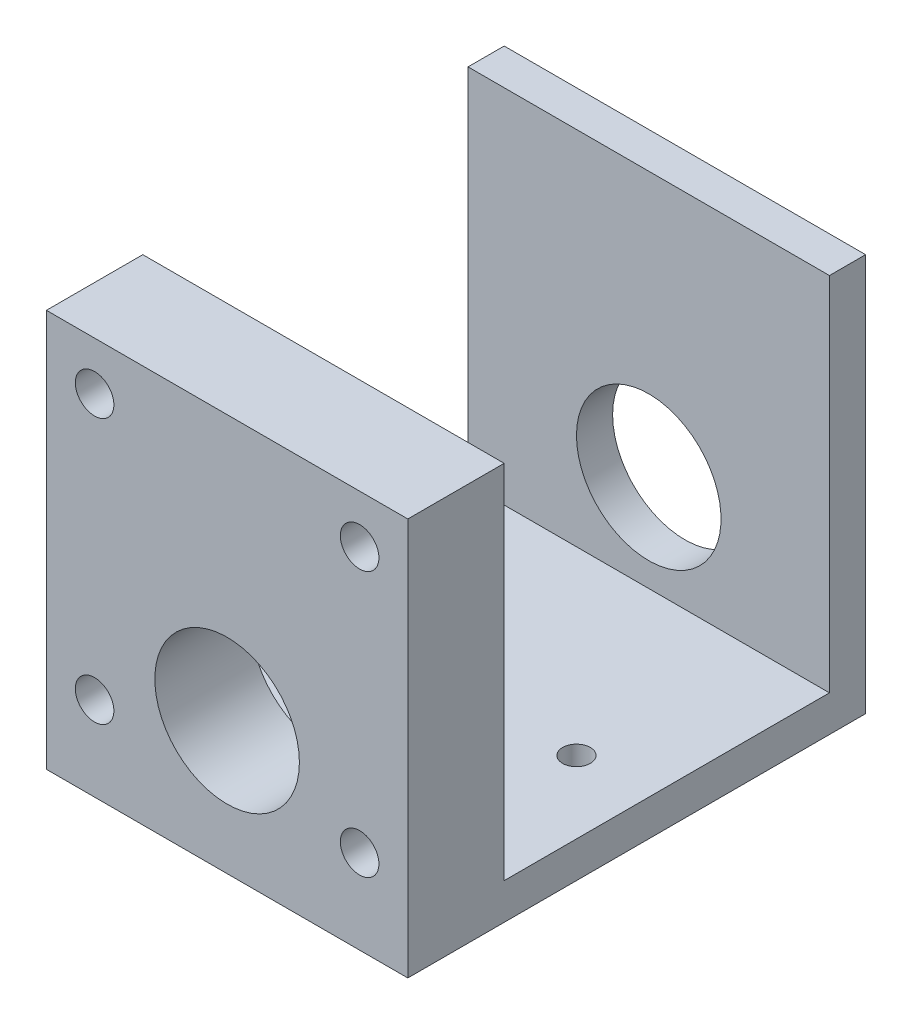
from build123d import *

# Parameters (mm, degrees)
SKETCH1_W           = 30
SKETCH1_H           = 30
SKETCH1_R           = 1.15
BOSS_EXTRUDE1_DEPTH = 3
SKETCH2_W           = 30
SKETCH2_H           = 3
BOSS_EXTRUDE2_DEPTH = 30
CUT_EXTRUDE1_REACH  = 55.749
SKETCH3_R           = 6
SKETCH4_W           = 30
SKETCH4_H           = 33
SKETCH4_R           = 6
BOSS_EXTRUDE3_DEPTH = 3
CUT_EXTRUDE3_REACH  = 57.48
SKETCH5_R           = 1.6
BOSS_EXTRUDE4_START = 5
SKETCH6_W           = 30
SKETCH6_H           = 33
SKETCH6_R           = 6
SKETCH6_R_2         = 1.6
BOSS_EXTRUDE4_DEPTH = 5


with BuildPart() as part:
    # Sketch1 → Boss-Extrude1 (new body)
    with BuildSketch(Plane(origin=(0, 0, 0), x_dir=(1, 0, 0), z_dir=(0, 1, 0))):
        with Locations((15, 15)):
            Rectangle(SKETCH1_W, SKETCH1_H)
        with Locations((5.999988, 12)):
            Circle(SKETCH1_R, mode=Mode.SUBTRACT)
        with Locations((23.999988, 12)):
            Circle(SKETCH1_R, mode=Mode.SUBTRACT)
    extrude(amount=BOSS_EXTRUDE1_DEPTH)

    # Sketch2 → Boss-Extrude2 (add)
    with BuildSketch(Plane(origin=(0, 3, 0), x_dir=(1, 0, 0), z_dir=(0, 1, 0))):
        with Locations((15, 28.5)):
            Rectangle(SKETCH2_W, SKETCH2_H)
    extrude(amount=BOSS_EXTRUDE2_DEPTH)

    # Sketch3 → Cut-Extrude1 (cut, up to next)
    with BuildSketch(Plane(origin=(0, 0, -30), x_dir=(-1, 0, 0), z_dir=(0, 0, -1)), mode=Mode.PRIVATE) as cut_extrude1_sk1:
        with Locations((-15, 11)):
            Circle(SKETCH3_R)
    cut_extrude1_tool1 = extrude(cut_extrude1_sk1.sketch, amount=-CUT_EXTRUDE1_REACH, mode=Mode.PRIVATE) & part.part
    add(cut_extrude1_tool1.solids().sort_by_distance((15, 11, -30))[0], mode=Mode.SUBTRACT)

    # Sketch4 → Boss-Extrude3 (add)
    with BuildSketch(Plane.XY):
        with Locations((15, 16.5)):
            Rectangle(SKETCH4_W, SKETCH4_H)
        with Locations((15, 11)):
            Circle(SKETCH4_R, mode=Mode.SUBTRACT)
    extrude(amount=BOSS_EXTRUDE3_DEPTH)

    # Sketch5 → Cut-Extrude3 (cut, up to next)
    with BuildSketch(Plane.XY.offset(3), mode=Mode.PRIVATE) as cut_extrude3_sk1:
        with Locations((26, 7)):
            Circle(SKETCH5_R)
    cut_extrude3_tool1 = extrude(cut_extrude3_sk1.sketch, amount=-CUT_EXTRUDE3_REACH, mode=Mode.PRIVATE) & part.part
    # Sketch5 → Cut-Extrude3 (cut, up to next)
    with BuildSketch(Plane.XY.offset(3), mode=Mode.PRIVATE) as cut_extrude3_sk2:
        with Locations((4, 7)):
            Circle(SKETCH5_R)
    cut_extrude3_tool2 = extrude(cut_extrude3_sk2.sketch, amount=-CUT_EXTRUDE3_REACH, mode=Mode.PRIVATE) & part.part
    # Sketch5 → Cut-Extrude3 (cut, up to next)
    with BuildSketch(Plane.XY.offset(3), mode=Mode.PRIVATE) as cut_extrude3_sk3:
        with Locations((4, 29)):
            Circle(SKETCH5_R)
    cut_extrude3_tool3 = extrude(cut_extrude3_sk3.sketch, amount=-CUT_EXTRUDE3_REACH, mode=Mode.PRIVATE) & part.part
    # Sketch5 → Cut-Extrude3 (cut, up to next)
    with BuildSketch(Plane.XY.offset(3), mode=Mode.PRIVATE) as cut_extrude3_sk4:
        with Locations((26, 29)):
            Circle(SKETCH5_R)
    cut_extrude3_tool4 = extrude(cut_extrude3_sk4.sketch, amount=-CUT_EXTRUDE3_REACH, mode=Mode.PRIVATE) & part.part
    add(cut_extrude3_tool1.solids().sort_by_distance((26, 7, 3))[0], mode=Mode.SUBTRACT)
    add(cut_extrude3_tool2.solids().sort_by_distance((4, 7, 3))[0], mode=Mode.SUBTRACT)
    add(cut_extrude3_tool3.solids().sort_by_distance((4, 29, 3))[0], mode=Mode.SUBTRACT)
    add(cut_extrude3_tool4.solids().sort_by_distance((26, 29, 3))[0], mode=Mode.SUBTRACT)

    # Sketch6 → Boss-Extrude4 (add)
    with BuildSketch(Plane.XY.offset(3).offset(BOSS_EXTRUDE4_START)):
        with Locations((15, 16.5)):
            Rectangle(SKETCH6_W, SKETCH6_H)
        with Locations((15, 11)):
            Circle(SKETCH6_R, mode=Mode.SUBTRACT)
        with Locations((4, 7)):
            Circle(SKETCH6_R_2, mode=Mode.SUBTRACT)
        with Locations((4, 29)):
            Circle(SKETCH6_R_2, mode=Mode.SUBTRACT)
        with Locations((26, 29)):
            Circle(SKETCH6_R_2, mode=Mode.SUBTRACT)
        with Locations((26, 7)):
            Circle(SKETCH6_R_2, mode=Mode.SUBTRACT)
    extrude(amount=-BOSS_EXTRUDE4_DEPTH)


solid = part.part
